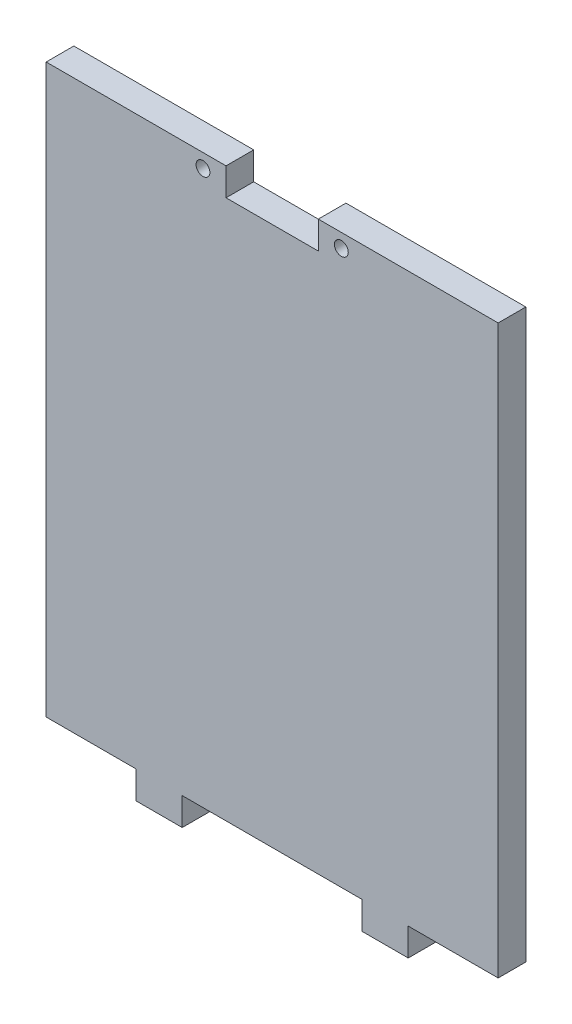
from build123d import *

# Parameters (mm, degrees)
ESQUISSE1_W             = 98
ESQUISSE1_H             = 123
BOSS_EXTRU_1_DEPTH      = 6
ESQUISSE2_W             = 10
ESQUISSE2_H             = 6
BOSS_EXTRU_2_DEPTH      = 6
ESQUISSE3_R             = 1.5
ENL_V_MAT_EXTRU_1_DEPTH = 6
ESQUISSE4_W             = 20
ESQUISSE4_H             = 6
ENL_V_MAT_EXTRU_2_DEPTH = 6


with BuildPart() as part:
    # Esquisse1 → Boss.-Extru.1 (new body)
    with BuildSketch(Plane.XY):
        Rectangle(ESQUISSE1_W, ESQUISSE1_H)
    extrude(amount=BOSS_EXTRU_1_DEPTH)

    # Esquisse2 → Boss.-Extru.2 (add)
    with BuildSketch(Plane.XY.offset(6)):
        with Locations((24.5, -64.5)):
            Rectangle(ESQUISSE2_W, ESQUISSE2_H)
        with Locations((-24.5, -64.5)):
            Rectangle(ESQUISSE2_W, ESQUISSE2_H)
    extrude(amount=-BOSS_EXTRU_2_DEPTH)

    # Esquisse3 → Enlèv. mat.-Extru.1 (cut)
    with BuildSketch(Plane.XY.offset(6)):
        with Locations((-15, 58.5)):
            Circle(ESQUISSE3_R)
        with Locations((15, 58.5)):
            Circle(ESQUISSE3_R)
    extrude(amount=-ENL_V_MAT_EXTRU_1_DEPTH, mode=Mode.SUBTRACT)

    # Esquisse4 → Enlèv. mat.-Extru.2 (cut)
    with BuildSketch(Plane.XY.offset(6)):
        with Locations((0, 58.5)):
            Rectangle(ESQUISSE4_W, ESQUISSE4_H)
    extrude(amount=-ENL_V_MAT_EXTRU_2_DEPTH, mode=Mode.SUBTRACT)


solid = part.part
